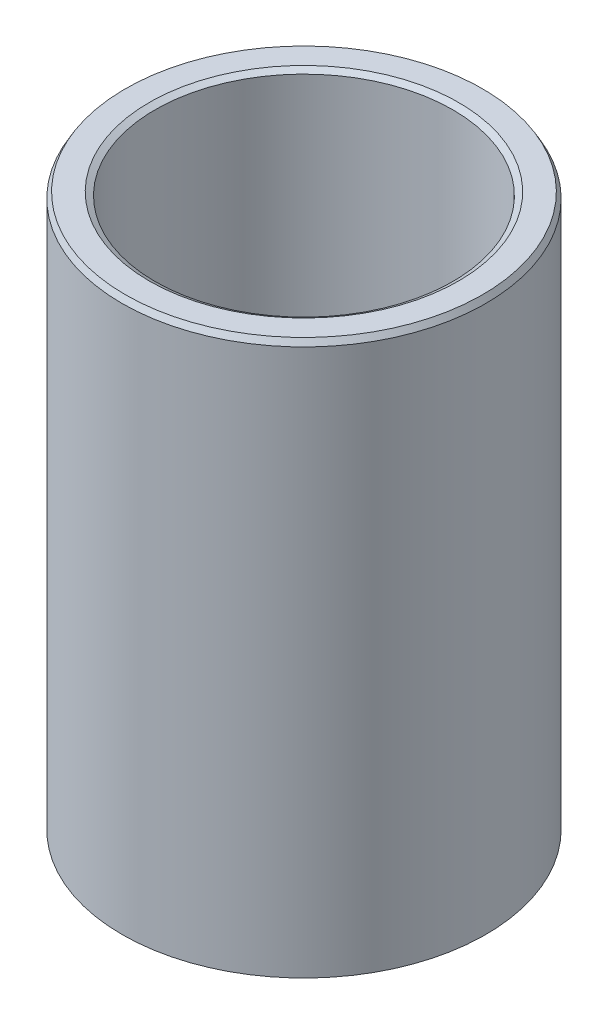
from build123d import *
from OCP.BRepFilletAPI import BRepFilletAPI_MakeChamfer

# Parameters (mm, degrees)
SKETCH1_R           = 42.5
BOSS_EXTRUDE1_DEPTH = 129.873883918
SKETCH2_R           = 34.782575445
CUT_EXTRUDE1_DEPTH  = 144.107392275
CHAMFER1_SIZE       = 1.36429436
CHAMFER1_SIZE2      = 0.787675716


with BuildPart() as part:
    # Sketch1 → Boss-Extrude1 (new body)
    with BuildSketch(Plane(origin=(0, 0, 0), x_dir=(1, 0, 0), z_dir=(0, 1, 0))):
        Circle(SKETCH1_R)
    extrude(amount=BOSS_EXTRUDE1_DEPTH)

    # Sketch2 → Cut-Extrude1 (cut, through all)
    with BuildSketch(Plane(origin=(0, 0, 0), x_dir=(1, 0, 0), z_dir=(0, 1, 0))):
        Circle(SKETCH2_R)
    extrude(amount=CUT_EXTRUDE1_DEPTH, mode=Mode.SUBTRACT)

    # Chamfer1: one chamfer whose edges measure the first distance from different faces: ONE call of the kernel's chamfer builder (chamfer() names one face for all edges)
    chamfer1_edges_1 = [part.edges().sort_by_distance(p)[0] for p in [
        (-34.782575445, 129.873883918, 0),
    ]]
    chamfer1_side_1 = [part.faces().sort_by_distance(p)[0] for p in [
        (-41.297918472, 129.873883918, 0),
    ]]
    chamfer1_edges_2 = [part.edges().sort_by_distance(p)[0] for p in [
        (-34.782575445, 0, 0),
    ]]
    chamfer1_side_2 = [part.faces().sort_by_distance(p)[0] for p in [
        (-34.782575445, 64.936941959, 0),
    ]]
    chamfer1_edges_3 = [part.edges().sort_by_distance(p)[0] for p in [
        (-42.5, 0, 0),
    ]]
    chamfer1_side_3 = [part.faces().sort_by_distance(p)[0] for p in [
        (-41.297918472, 0, 0),
    ]]
    chamfer1_edges_4 = [part.edges().sort_by_distance(p)[0] for p in [
        (-42.5, 129.873883918, 0),
    ]]
    chamfer1_side_4 = [part.faces().sort_by_distance(p)[0] for p in [
        (-42.5, 64.936941959, 0),
    ]]
    chamfer1 = BRepFilletAPI_MakeChamfer(part.part.solid().wrapped)
    for e in chamfer1_edges_1:
        chamfer1.Add(CHAMFER1_SIZE, CHAMFER1_SIZE2, e.wrapped, chamfer1_side_1[0].wrapped)  # the first distance lies on this face
    for e in chamfer1_edges_2:
        chamfer1.Add(CHAMFER1_SIZE, CHAMFER1_SIZE2, e.wrapped, chamfer1_side_2[0].wrapped)  # the first distance lies on this face
    for e in chamfer1_edges_3:
        chamfer1.Add(CHAMFER1_SIZE, CHAMFER1_SIZE2, e.wrapped, chamfer1_side_3[0].wrapped)  # the first distance lies on this face
    for e in chamfer1_edges_4:
        chamfer1.Add(CHAMFER1_SIZE, CHAMFER1_SIZE2, e.wrapped, chamfer1_side_4[0].wrapped)  # the first distance lies on this face
    add(Compound.cast(chamfer1.Shape()), mode=Mode.REPLACE)


solid = part.part
